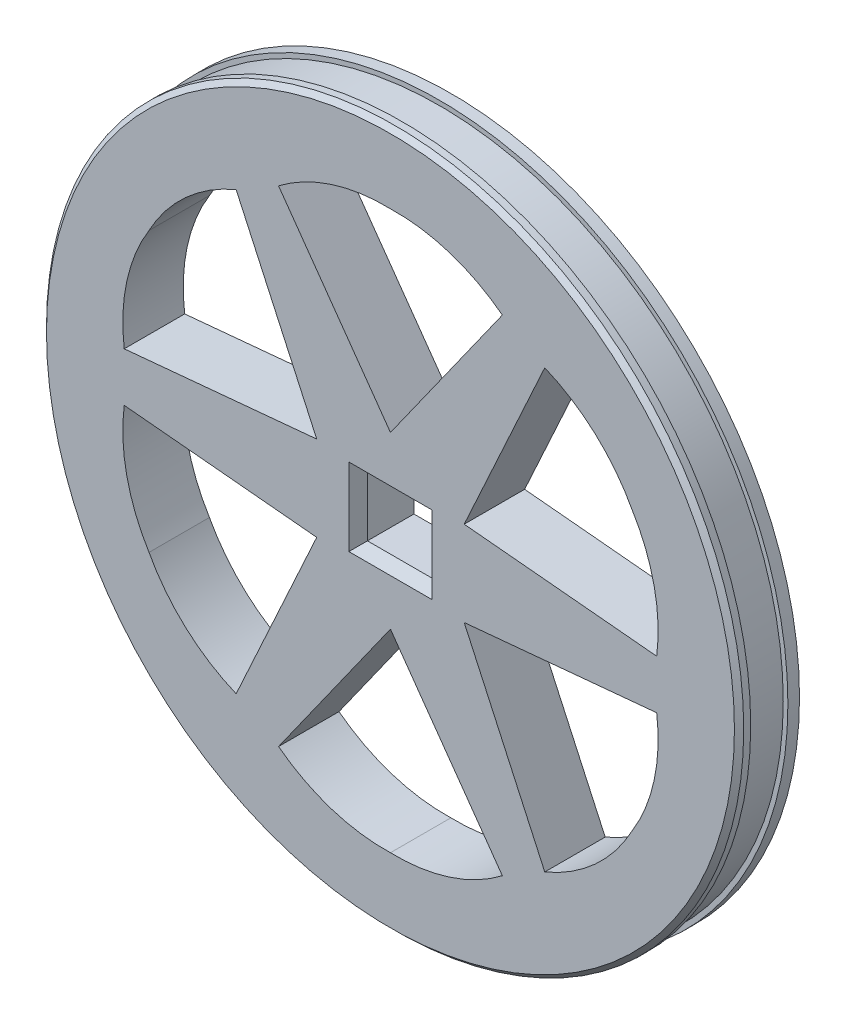
from build123d import *

# Parameters (mm, degrees)
SKETCH1_R           = 37.5
SKETCH1_W           = 7.95
SKETCH1_H           = 7.35
BOSS_EXTRUDE1_DEPTH = 3.25
CUT_EXTRUDE1_DEPTH  = 4
CIRPATTERN1_COUNT   = 6
SKETCH3_R           = 37.5
SKETCH3_R_2         = 37
CUT_EXTRUDE2_DEPTH  = 2
CHAMFER1_SIZE       = 0.5
CHAMFER1_SIZE2      = 1.5
CHAMFER2_SIZE       = 0.5


with BuildPart() as part:
    # Sketch1 → Boss-Extrude1 (new, symmetric)
    with BuildSketch(Plane.XY):
        Circle(SKETCH1_R)
        Rectangle(SKETCH1_W, SKETCH1_H, mode=Mode.SUBTRACT)
    extrude(amount=BOSS_EXTRUDE1_DEPTH, both=True)

    # Sketch2 → Cut-Extrude1 (cut, symmetric)
    with BuildSketch(Plane.XY):
        with BuildLine():
            Line((0, 9.158641407), (-12.037071564, 26.115211784))
            ThreePointArc((-12.037071564, 26.115211784), (-6.351662121, 29.087034336), (0, 29.988143709))
            ThreePointArc((0, 29.988143709), (6.351662121, 29.087034336), (12.037071564, 26.115211784))
            Line((12.037071564, 26.115211784), (0, 9.158641407))
        make_face()
    cut_extrude1 = extrude(amount=CUT_EXTRUDE1_DEPTH, both=True, mode=Mode.SUBTRACT)

    # CirPattern1: Cut-Extrude1 ×6 about axis
    cirpattern1_axis = Axis((0, 0, 3.25), (0, 0, -1))
    for i in range(1, CIRPATTERN1_COUNT):
        add(cut_extrude1.rotate(cirpattern1_axis, i * 360 / CIRPATTERN1_COUNT), mode=Mode.SUBTRACT)

    # Sketch3 → Cut-Extrude2 (cut, symmetric)
    with BuildSketch(Plane.XY):
        Circle(SKETCH3_R)
        Circle(SKETCH3_R_2, mode=Mode.SUBTRACT)
    extrude(amount=CUT_EXTRUDE2_DEPTH, both=True, mode=Mode.SUBTRACT)

    # Chamfer1
    chamfer1_edges = [part.edges().sort_by_distance(p)[0] for p in [
        (3.975, 0, 3.25),
        (0, 3.675, 3.25),
        (-3.975, 0, 3.25),
        (0, -3.675, 3.25),
    ]]
    chamfer1_side = [part.faces().sort_by_distance(p)[0] for p in [
        (-36.439339828, 0, 3.25),
    ]]
    chamfer(chamfer1_edges, length=CHAMFER1_SIZE, length2=CHAMFER1_SIZE2, reference=chamfer1_side[0])

    # Chamfer2
    chamfer2_edges = [part.edges().sort_by_distance(p)[0] for p in [
        (-37.5, 0, 3.25),
    ]]
    chamfer(chamfer2_edges, length=CHAMFER2_SIZE)


solid = part.part
